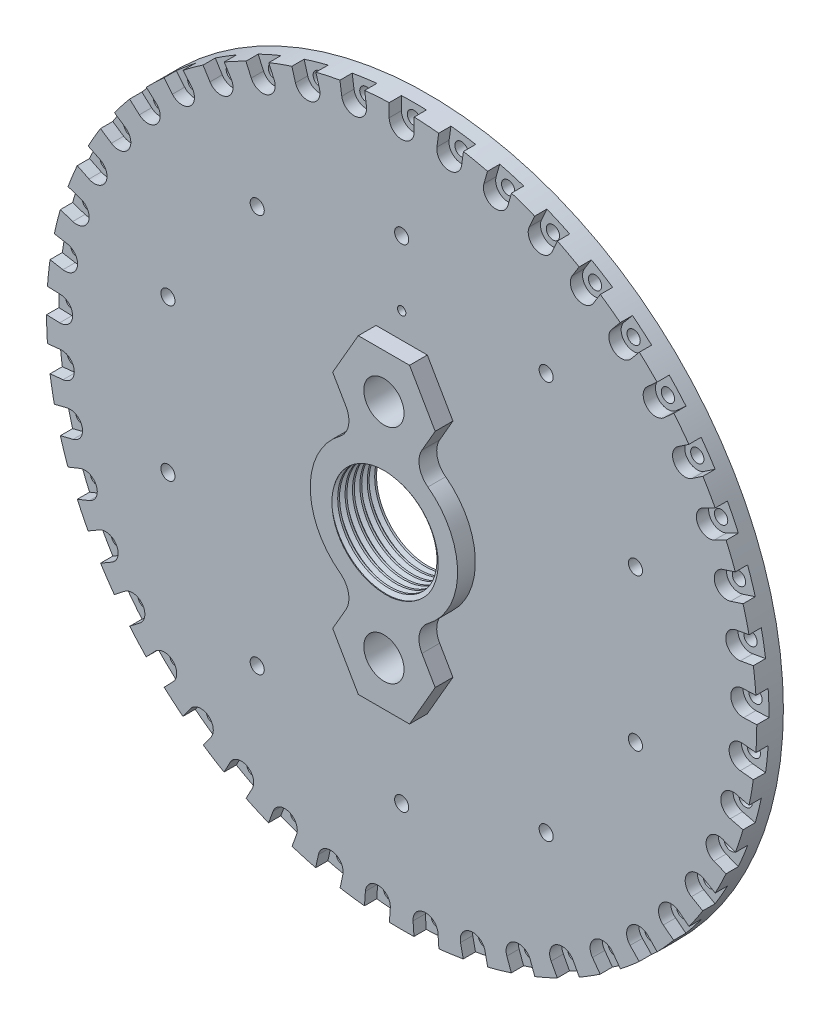
from build123d import *

# Parameters (mm, degrees)
THREAD1_PITCH                                  = 2.116666667
BOSS_EXTRUDE1_DEPTH                            = 5.08
F_1_2_20_TAPPED_HOLE2_D                        = 11.50874
CBORE_FOR_6_SOCKET_HEAD_CAP_SCREW1_D           = 3.7973
CBORE_FOR_6_SOCKET_HEAD_CAP_SCREW1_CBORE_D     = 7.14502
CBORE_FOR_6_SOCKET_HEAD_CAP_SCREW1_CBORE_DEPTH = 3.5052
CUT_EXTRUDE1_DEPTH                             = 3.5052
CIRPATTERN2_COUNT                              = 45
FILLET1_R                                      = 6.35
F_3_32_0_09375_DOWEL_HOLE1_D                   = 2.38125
CIRPATTERN1_COUNT                              = 10


with BuildPart() as part:
    # Sketch1 → Revolve1 (revolve)
    with BuildSketch(Plane(origin=(0, 0, 0), x_dir=(0, 0, -1), z_dir=(1, 0, 0)), mode=Mode.PRIVATE) as revolve1_sk:
        Polygon((0, 21.082), (0, 101.6), (7.62, 101.6), (7.62, 88.6333), (5.6642, 88.6333), (5.6642, 85.1027), (7.62, 85.1027), (7.62, 83.82), (5.08, 83.82), (5.08, 56.8325), (7.62, 56.8325), (7.62, 53.0225), (6.35, 53.0225), (6.35, 50.4825), (7.62, 50.4825), (7.62, 49.6951), (6.2992, 49.6951), (6.2992, 47.0535), (7.62, 47.0535), (7.62, 46.0375), (5.08, 46.0375), (5.08, 21.59), (7.62, 21.59), (7.62, 14.732), (-5.08, 14.732), (-5.08, 21.082), align=None)
    revolve(revolve1_sk.sketch.rotate(Axis((0, 0, 0), (0, 0, -1)), 90), axis=Axis((0, 0, 0), (0, 0, -1)))

    # Thread1: arcs per turn and ends read off the stored shape
    # Thread1: the profile of Thread Profile1 profile screwed along a right-hand helix through 8.04 turns, 10 arcs to a turn; built about Z, then put on its axis
    thread1_z = Axis((0, 0, 0), (0, 0, 1))
    thread1_corners = [(14.7317, 0, -0.000173205), (15.877679435, 0, 0.66145833), (15.877679435, 0, 0.926041664), (14.7317, 0, 1.587673199)]
    with BuildLine(mode=Mode.PRIVATE) as thread1_profile:
        Line(thread1_corners[0], thread1_corners[1])
        Line(thread1_corners[1], thread1_corners[2])
        Line(thread1_corners[2], thread1_corners[3])
        Line(thread1_corners[3], thread1_corners[0])
    thread1_cap = Face(thread1_profile.wire())
    thread1_turn_angles = [0, 18, 36, 54, 72, 90, 108, 126, 144, 162, 180, 198, 216, 234, 252, 270, 288, 306, 324, 342, 360]
    thread1_turn_weights = [1, 0.9510565162951535, 1, 0.9510565162951535, 1, 0.9510565162951535, 1, 0.9510565162951535, 1, 0.9510565162951535, 1, 0.9510565162951535, 1, 0.9510565162951535, 1, 0.9510565162951535, 1, 0.9510565162951535, 1, 0.9510565162951535, 1]
    thread1_turn_rails = [Edge.make_bspline([Vector(p[0], p[1], 0).rotate(thread1_z, thread1_turn_angles[k]) / thread1_turn_weights[k] + Vector(0, 0, p[2] + THREAD1_PITCH * thread1_turn_angles[k] / 360) for k in range(21)], [0, 0, 0, 1, 1, 2, 2, 3, 3, 4, 4, 5, 5, 6, 6, 7, 7, 8, 8, 9, 9, 10, 10, 10], 2, thread1_turn_weights) for p in thread1_corners]
    thread1_turn_sides = [Face.make_surface_from_curves(thread1_turn_rails[p[0]], thread1_turn_rails[p[1]]) for p in [(0, 1), (1, 2), (2, 3), (3, 0)]]
    thread1_last_angles = [2880, 2887.2, 2894.4]
    thread1_last_weights = [1, 0.9921147013144778, 1]
    thread1_last_rails = [Edge.make_bspline([Vector(p[0], p[1], 0).rotate(thread1_z, thread1_last_angles[k]) / thread1_last_weights[k] + Vector(0, 0, p[2] + THREAD1_PITCH * thread1_last_angles[k] / 360) for k in range(3)], [0, 0, 0, 1, 1, 1], 2, thread1_last_weights) for p in thread1_corners]
    thread1_last_sides = [Face.make_surface_from_curves(thread1_last_rails[p[0]], thread1_last_rails[p[1]]) for p in [(0, 1), (1, 2), (2, 3), (3, 0)]]
    thread1 = Plane(origin=(0, 0, 9.398), x_dir=(-1, 0, 0), z_dir=(0, 0, -1)) * Solid(Shell([*[p.moved(Location((0, 0, THREAD1_PITCH * i))) for i in range(8) for p in thread1_turn_sides], *thread1_last_sides, thread1_cap, thread1_cap.rotate(thread1_z, 2894.4).moved(Location((0, 0, THREAD1_PITCH * 2894.4 / 360)))]))
    add(thread1, mode=Mode.SUBTRACT)

    # Sketch15 → Boss-Extrude1 (add)
    with BuildSketch(Plane.XY):
        Polygon((7.332348419, 19.05), (14.664696837, 31.75), (7.332348419, 44.45), (-7.332348419, 44.45), (-14.664696837, 31.75), (-7.332348419, 19.05), align=None)
        Polygon((-7.332348419, -19.05), (7.332348419, -19.05), (14.664696837, -31.75), (7.332348419, -44.45), (-7.332348419, -44.45), (-14.664696837, -31.75), align=None)
    extrude(amount=BOSS_EXTRUDE1_DEPTH)

    # 1/2-20 Tapped Hole2 (through all)
    with Locations(Plane.XY.offset(5.08)):
        with Locations((0, 31.75), (0, -31.75)):
            Hole(F_1_2_20_TAPPED_HOLE2_D / 2)

    # CBORE for #6 Socket Head Cap Screw1 (through all)
    with Locations(Plane.XY):
        with Locations((0, 97.79), (13.609737543, 96.838314442), (26.954577025, 94.001781246), (39.774776326, 89.335610303), (51.820804849, 82.930623323), (62.858200351, 74.911486093), (72.672132483, 65.434281996), (81.07158422, 54.68347403), (87.893069788, 42.868314445), (93.003816729, 30.21877188), (96.304350167, 16.981055294), (97.730428974, 3.412821783), (97.254296148, -10.221838423), (94.885219073, -23.657542171), (90.669309138, -36.63277877), (84.688624236, -48.895), (77.059571595, -60.205535672), (67.930642047, -70.344239075), (57.479519822, -79.11377188), (45.909624125, -86.343445106), (33.446149816, -91.892541387), (20.331684245, -95.653053876), (6.821485567, -97.551788475), (-6.821485567, -97.551788475), (-20.331684245, -95.653053876), (-33.446149816, -91.892541387), (-45.909624125, -86.343445106), (-57.479519822, -79.11377188), (-67.930642047, -70.344239075), (-77.059571595, -60.205535672), (-84.688624236, -48.895), (-90.669309138, -36.63277877), (-94.885219073, -23.657542171), (-97.254296148, -10.221838423), (-97.730428974, 3.412821783), (-96.304350167, 16.981055294), (-93.003816729, 30.21877188), (-87.893069788, 42.868314445), (-81.07158422, 54.68347403), (-72.672132483, 65.434281996), (-62.858200351, 74.911486093), (-51.820804849, 82.930623323), (-39.774776326, 89.335610303), (-26.954577025, 94.001781246), (-13.609737543, 96.838314442)):
            CounterBoreHole(CBORE_FOR_6_SOCKET_HEAD_CAP_SCREW1_D / 2, CBORE_FOR_6_SOCKET_HEAD_CAP_SCREW1_CBORE_D / 2, CBORE_FOR_6_SOCKET_HEAD_CAP_SCREW1_CBORE_DEPTH)

    # Sketch29 → Cut-Extrude1 (cut)
    with BuildSketch(Plane.XY):
        with BuildLine():
            ThreePointArc((-3.57251, 97.79), (0, 101.36251), (3.57251, 97.79))
            Line((3.57251, 97.79), (3.57251, 101.537171382))
            ThreePointArc((3.57251, 101.537171382), (0, 101.6), (-3.57251, 101.537171382))
            Line((-3.57251, 101.537171382), (-3.57251, 97.79))
        make_face()
    cut_extrude1 = extrude(amount=-CUT_EXTRUDE1_DEPTH, mode=Mode.SUBTRACT)

    # CirPattern2: Cut-Extrude1 ×45 about axis
    cirpattern2_axis = Axis((0, 0, 0), (0, 0, 1))
    for i in range(1, CIRPATTERN2_COUNT):
        add(cut_extrude1.rotate(cirpattern2_axis, i * 360 / CIRPATTERN2_COUNT), mode=Mode.SUBTRACT)

    # Fillet1
    fillet1_edges = [part.edges().sort_by_distance(p)[0] for p in [
        (-7.671143055, -19.636809523, 2.54),
        (7.671143055, -19.636809523, 2.54),
        (-7.671143055, 19.636809523, 2.54),
        (7.671143055, 19.636809523, 2.54),
    ]]
    fillet(fillet1_edges, radius=FILLET1_R)

    # 3/32 (0.09375) Dowel Hole1 (through all)
    with Locations(Plane(origin=(0, 0, -6.35), x_dir=(-1, 0, 0), z_dir=(0, 0, -1))):
        with Locations((0, 51.7525)):
            Hole(F_3_32_0_09375_DOWEL_HOLE1_D / 2)

    # Sketch27 → #10-32 Tapped Hole1 (revolve, cut)
    with BuildSketch(Plane(origin=(0, 70.32625, 0), x_dir=(0, -1, 0), z_dir=(1, 0, 0))):
        Polygon((0, 0), (0, 4.318), (2.0193, 3.104682152), (2.0193, 0), align=None)
    f_10_32_tapped_hole1 = revolve(axis=Axis((0, 70.32625, 6.35), (0, 0, -1)), mode=Mode.SUBTRACT)

    # CirPattern1: #10-32 Tapped Hole1 ×10 about axis
    cirpattern1_axis = Axis((0, 0, 0), (0, 0, 1))
    for i in range(1, CIRPATTERN1_COUNT):
        add(f_10_32_tapped_hole1.rotate(cirpattern1_axis, i * 360 / CIRPATTERN1_COUNT), mode=Mode.SUBTRACT)


solid = part.part
